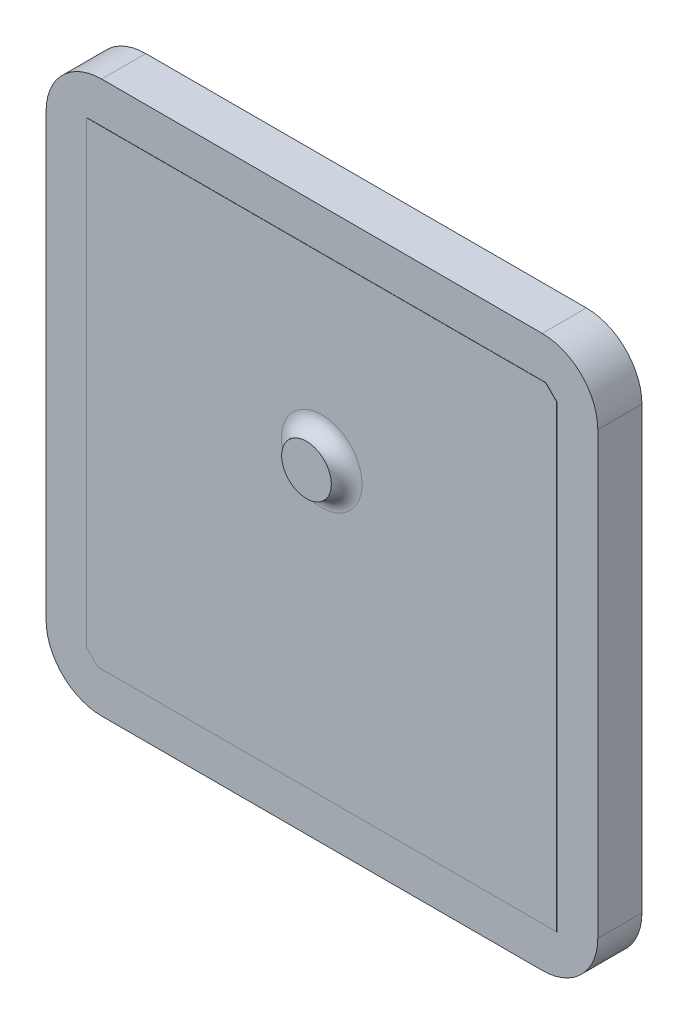
from build123d import *

# Parameters (mm, degrees)
SKETCH1_W           = 25
SKETCH1_H           = 25
BOSS_EXTRUDE1_DEPTH = 2
SKETCH4_R           = 1.125
BOSS_EXTRUDE3_DEPTH = 0.7
SKETCH5_W           = 21.3
SKETCH5_H           = 21.3
BOSS_EXTRUDE4_DEPTH = 0.01
FILLET1_R           = 0.7
CHAMFER1_SIZE       = 0.5
CUT_EXTRUDE1_DEPTH  = 18.790446875
SKETCH7_R           = 0.4
BOSS_EXTRUDE5_DEPTH = 2


with BuildPart() as part:
    # Sketch1 → Boss-Extrude1 (new body)
    with BuildSketch(Plane.XY):
        Rectangle(SKETCH1_W, SKETCH1_H)
    extrude(amount=BOSS_EXTRUDE1_DEPTH)

    # Sketch4 → Boss-Extrude3 (add)
    with BuildSketch(Plane.XY.offset(2)):
        with Locations((0, 2.5)):
            Circle(SKETCH4_R)
    extrude(amount=BOSS_EXTRUDE3_DEPTH)

    # Sketch5 → Boss-Extrude4 (add)
    with BuildSketch(Plane.XY.offset(2)):
        Rectangle(SKETCH5_W, SKETCH5_H)
    extrude(amount=BOSS_EXTRUDE4_DEPTH)

    # Fillet1
    # the kernel refuses this fillet: 0.7 mm, written as the material it adds along each edge
    with BuildSketch(Plane(origin=(0, 2.5, 2.01), x_dir=(1, 0, 0), z_dir=(0, 1, 0))) as fillet1_piece_1_section:
        with BuildLine():
            CenterArc((1.125 + FILLET1_R, -FILLET1_R), FILLET1_R, 90, 90)
            Line((1.125, -FILLET1_R), (1.125, 0))
            Line((1.125, 0), (1.125 + FILLET1_R, 0))
        make_face()
    fillet1_piece_1 = revolve(axis=Axis((0, 2.5, 2.01), (0, 0, -1)), mode=Mode.PRIVATE)
    fillet1_piece_1 = split(fillet1_piece_1, bisect_by=Plane(origin=(-1.326537578, 2.5, 2.7), z_dir=(0, 0, -1)), keep=Keep.TOP, mode=Mode.PRIVATE)
    add(fillet1_piece_1)

    # Chamfer1
    chamfer1_edges = [part.edges().sort_by_distance(p)[0] for p in [
        (-10.65, -10.65, 2.005),
        (10.65, 10.65, 2.005),
    ]]
    chamfer(chamfer1_edges, length=CHAMFER1_SIZE)

    # Sketch6 → Cut-Extrude1 (cut, through all)
    with BuildSketch(Plane.XY.offset(2)):
        with BuildLine():
            Line((12.5, 9.98277308), (12.5, 12.5))
            Line((12.5, 12.5), (9.98277308, 12.5))
            ThreePointArc((9.98277308, 12.5), (11.762721305, 11.762721305), (12.5, 9.98277308))
        make_face()
        with BuildLine():
            Line((-9.98277308, 12.5), (-12.5, 12.5))
            Line((-12.5, 12.5), (-12.5, 9.98277308))
            ThreePointArc((-12.5, 9.98277308), (-11.762721305, 11.762721305), (-9.98277308, 12.5))
        make_face()
        with BuildLine():
            Line((-12.5, -9.98277308), (-12.5, -12.5))
            Line((-12.5, -12.5), (-9.98277308, -12.5))
            ThreePointArc((-9.98277308, -12.5), (-11.762721305, -11.762721305), (-12.5, -9.98277308))
        make_face()
        with BuildLine():
            Line((12.5, -9.98277308), (12.5, -12.5))
            Line((12.5, -12.5), (9.98277308, -12.5))
            ThreePointArc((9.98277308, -12.5), (11.762721305, -11.762721305), (12.5, -9.98277308))
        make_face()
    extrude(amount=-CUT_EXTRUDE1_DEPTH, mode=Mode.SUBTRACT)

    # Sketch7 → Boss-Extrude5 (add)
    with BuildSketch(Plane(origin=(0, 0, 0), x_dir=(-1, 0, 0), z_dir=(0, 0, -1))):
        with Locations(Location((0, 2.5, 0), (0, 0, 180))):
            Circle(SKETCH7_R)
    extrude(amount=BOSS_EXTRUDE5_DEPTH)


solid = part.part
